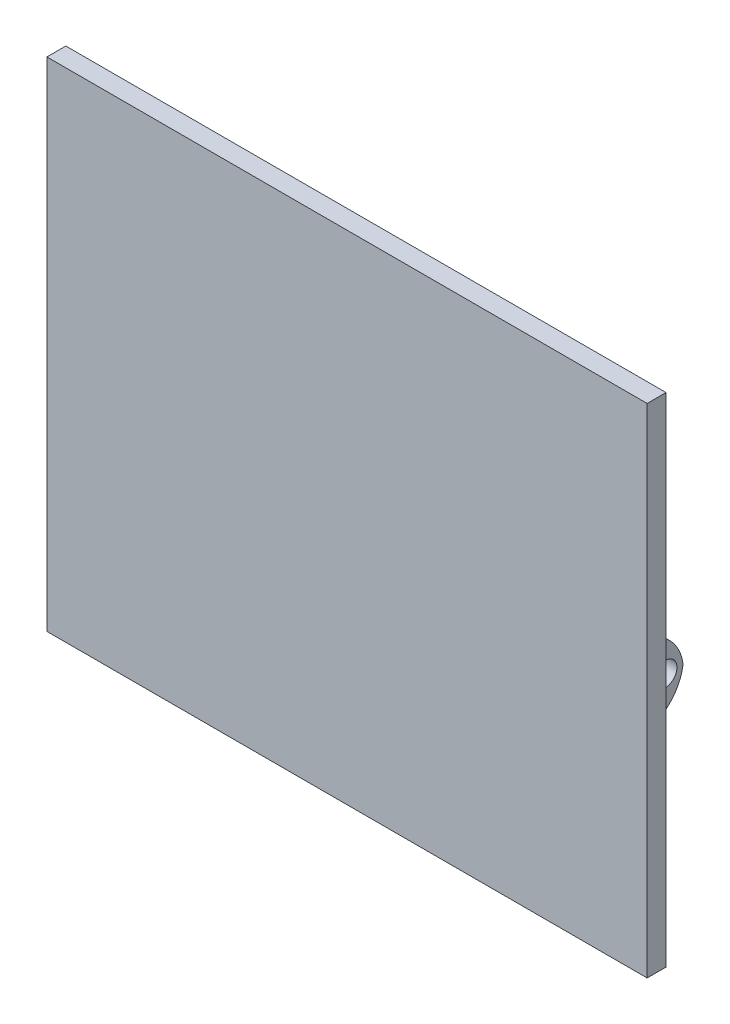
from build123d import *

# Parameters (mm, degrees)
BOSS_EXTRUDE1_START = 5
SKETCH2_W           = 63.507
SKETCH2_H           = 52.644
BOSS_EXTRUDE1_DEPTH = 2
SKETCH5_W           = 4.5
SKETCH5_H           = 3.844091241
BOSS_EXTRUDE2_DEPTH = 52.5
SKETCH8_W           = 3.84
SKETCH8_H           = 4.5
CUT_EXTRUDE1_DEPTH  = 5
SKETCH9_W           = 3.844091241
SKETCH9_H           = 4.5
CUT_EXTRUDE2_DEPTH  = 5
FILLET1_R           = 1
BOSS_EXTRUDE3_START = -2
SKETCH10_W          = 3.844091241
SKETCH10_H          = 8.427653373
BOSS_EXTRUDE3_DEPTH = 2.5
FILLET2_R           = 5
SKETCH11_R          = 1.25
CUT_EXTRUDE3_DEPTH  = 5
CUT_EXTRUDE4_START  = -5
SKETCH12_R          = 1.25
CUT_EXTRUDE4_DEPTH  = 5
SKETCH16_R          = 1.26021762
CUT_EXTRUDE5_DEPTH  = 4


with BuildPart() as part:
    # Sketch2 → Boss-Extrude1 (new body)
    with BuildSketch(Plane.XY.offset(20).offset(BOSS_EXTRUDE1_START)):
        with Locations((89.8185, 54.102)):
            Rectangle(SKETCH2_W, SKETCH2_H)
    extrude(amount=BOSS_EXTRUDE1_DEPTH)

    # Sketch5 → Boss-Extrude2 (add)
    with BuildSketch(Plane.XZ.offset(-27.78)):
        with Locations((60.315, 23.077954379)):
            Rectangle(SKETCH5_W, SKETCH5_H)
    extrude(amount=-BOSS_EXTRUDE2_DEPTH)

    # Sketch8 → Cut-Extrude1 (cut)
    with BuildSketch(Plane.ZY.offset(-58.065)):
        with Locations((23.075908759, 30.03)):
            Rectangle(SKETCH8_W, SKETCH8_H)
    extrude(amount=-CUT_EXTRUDE1_DEPTH, mode=Mode.SUBTRACT)

    # Sketch9 → Cut-Extrude2 (cut)
    with BuildSketch(Plane.ZY.offset(-58.065)):
        with Locations((23.077954379, 78.174)):
            Rectangle(SKETCH9_W, SKETCH9_H)
    extrude(amount=-CUT_EXTRUDE2_DEPTH, mode=Mode.SUBTRACT)

    # Fillet1
    fillet1_edges = [part.edges().sort_by_distance(p)[0] for p in [
        (58.065, 54.102, 21.155908759),
        (62.565, 54.102, 21.155908759),
    ]]
    fillet(fillet1_edges, radius=FILLET1_R)

    # Sketch10 → Boss-Extrude3 (add)
    with BuildSketch(Plane(origin=(121.572, 0, 0), x_dir=(0, 0, -1), z_dir=(1, 0, 0)).offset(BOSS_EXTRUDE3_START)):
        with Locations((-23.077954379, 52.638173314)):
            Rectangle(SKETCH10_W, SKETCH10_H)
    extrude(amount=-BOSS_EXTRUDE3_DEPTH)

    # Fillet2
    # the kernel refuses this fillet: 5 mm, written as the material it takes off along each edge
    with BuildSketch(Plane(origin=(131.733382256, 56.852, 21.155908759), x_dir=(0, 0, 1), z_dir=(-1, 0, 0))) as fillet2_piece_1:
        with BuildLine():
            CenterArc((5, -4.864552903), FILLET2_R, 103.366656392, 76.633343608)
            Line((0, -4.864552903), (-0.1, -4.864552903))
            Line((-0.1, -4.864552903), (-0.1, 0))
            Line((-0.1, 0), (0, 0.1))
            ThreePointArc((0, 0.1), (1.922045621, 0.1), (3.820973066, 0.097291058))
            Line((3.820973066, 0.097291058), (3.844091241, 0))
        make_face()
    extrude(amount=26.822764513, mode=Mode.SUBTRACT)
    with BuildSketch(Plane(origin=(131.733382256, 48.424346627, 21.155908759), x_dir=(0, 0, 1), z_dir=(-1, 0, 0))) as fillet2_piece_2:
        with BuildLine():
            CenterArc((5, 4.864552903), FILLET2_R, 180, 76.633343608)
            Line((0, 4.864552903), (-0.1, 4.864552903))
            Line((-0.1, 4.864552903), (-0.1, 0))
            Line((-0.1, 0), (0, -0.1))
            ThreePointArc((0, -0.1), (1.922045621, -0.1), (3.820973066, -0.097291058))
            Line((3.820973066, -0.097291058), (3.844091241, 0))
        make_face()
    extrude(amount=26.822764513, mode=Mode.SUBTRACT)

    # Sketch11 → Cut-Extrude3 (cut)
    with BuildSketch(Plane(origin=(0, 32.28, 0), x_dir=(-1, 0, 0), z_dir=(0, -1, 0))):
        with Locations(Location((-60.565, -23.295908759, 0), (0, 0, 90))):
            Circle(SKETCH11_R)
    extrude(amount=-CUT_EXTRUDE3_DEPTH, mode=Mode.SUBTRACT)

    # Sketch12 → Cut-Extrude4 (cut)
    with BuildSketch(Plane(origin=(0, 75.924, 0), x_dir=(1, 0, 0), z_dir=(0, 1, 0)).offset(CUT_EXTRUDE4_START)):
        with Locations(Location((60.565, -23.295908759, 0), (0, 0, 90))):
            Circle(SKETCH12_R)
    extrude(amount=CUT_EXTRUDE4_DEPTH, mode=Mode.SUBTRACT)

    # Sketch16 → Cut-Extrude5 (cut)
    with BuildSketch(Plane(origin=(119.572, 0, 0), x_dir=(0, 0, -1), z_dir=(1, 0, 0))):
        with Locations((-23.10766013, 52.666921641)):
            Circle(SKETCH16_R)
    extrude(amount=-CUT_EXTRUDE5_DEPTH, mode=Mode.SUBTRACT)


solid = part.part
